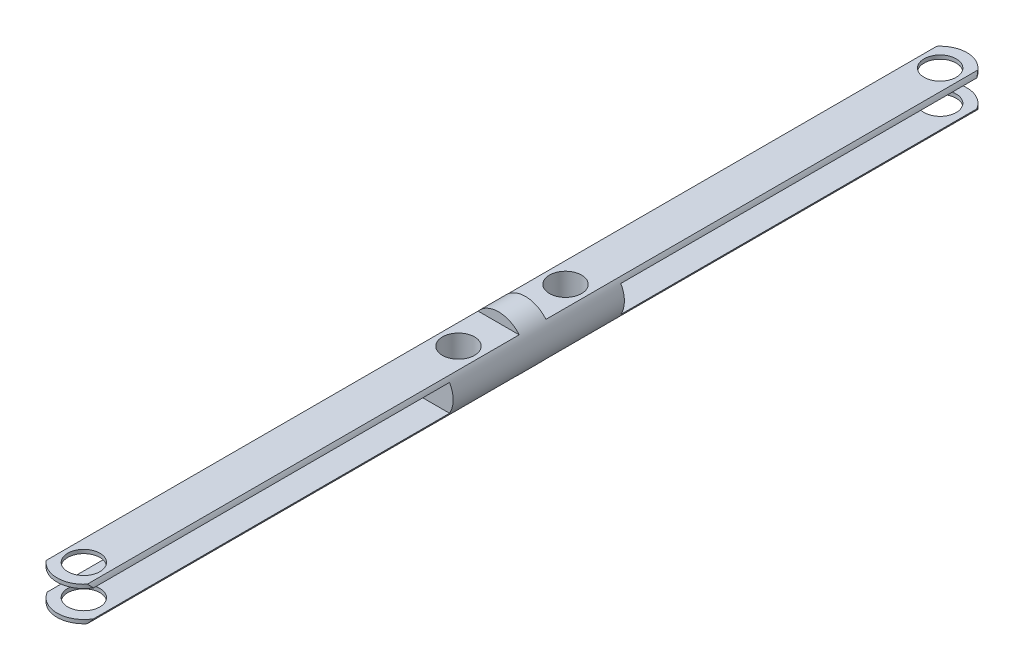
from build123d import *

# Parameters (mm, degrees)
EXTRUDE_1_DEPTH          = 100
CUT_EXTRUDE_START        = -1.6
CUT_EXTRUDE_2_OUTLINE_W  = 11.543856376
CUT_EXTRUDE_2_OUTLINE_H  = 103.894707388
CUT_EXTRUDE_2_OUTLINE_R  = 1.5
CUT_EXTRUDE_2_DEPTH      = 3.2
CUT_EXTRUDE_3_DEPTH      = 22
CUT_EXTRUDE_3_DEPTH_BACK = 22
SKETCH_6_W               = 64
SKETCH_6_H               = 2.5
EXTRUDE_START            = -1.25
SKETCH_7_R               = 2.5
EXTRUDE_2_DEPTH          = 1.25


# Read off the part's stored shape, not the designer's step: 切除-拉伸2
with BuildPart() as part:
    # 草图1 → 凸台-拉伸1 (new body)
    with BuildSketch(Plane.XY):
        with BuildLine():
            Line((1.920937271, 1.6), (0, 1.6))
            Line((0, 1.6), (0, -1.6))
            Line((0, -1.6), (1.920937271, -1.6))
            ThreePointArc((1.920937271, -1.6), (2.350781059, -0.850781059), (2.5, 0))
            ThreePointArc((2.5, 0), (2.350781059, 0.850781059), (1.920937271, 1.6))
        make_face()
        with BuildLine():
            Line((0, -1.6), (0, 1.6))
            Line((0, 1.6), (-1.920937271, 1.6))
            ThreePointArc((-1.920937271, 1.6), (-2.5, 0), (-1.920937271, -1.6))
            Line((-1.920937271, -1.6), (0, -1.6))
        make_face()
    extrude(amount=EXTRUDE_1_DEPTH)

    # 切除-拉伸2 outline → 切除-拉伸2 (cut)
    # profile 1 of 3: a face of its own
    with BuildSketch(Plane(origin=(0, 0, 0), x_dir=(1, 0, 0), z_dir=(0, 1, 0)).offset(CUT_EXTRUDE_START)):
        with Locations((0.333099219, -49.873134062)):
            Rectangle(CUT_EXTRUDE_2_OUTLINE_W, CUT_EXTRUDE_2_OUTLINE_H)
        with BuildLine():
            Line((-2.5, -50), (-2.5, -10))
            ThreePointArc((-2.5, -10), (0, -7.5), (2.5, -10))
            Line((2.5, -10), (2.5, -50))
            Line((2.5, -50), (-2.5, -50))
        make_face(mode=Mode.SUBTRACT)
    # profile 2 of 3: a face of its own
    with BuildSketch(Plane(origin=(0, 0, 0), x_dir=(1, 0, 0), z_dir=(0, 1, 0)).offset(CUT_EXTRUDE_START)):
        with Locations((0, -45)):
            Circle(CUT_EXTRUDE_2_OUTLINE_R)
    # profile 3 of 3: a face of its own
    with BuildSketch(Plane(origin=(0, 0, 0), x_dir=(1, 0, 0), z_dir=(0, 1, 0)).offset(CUT_EXTRUDE_START)):
        with Locations((0, -10)):
            Circle(CUT_EXTRUDE_2_OUTLINE_R)
    extrude(amount=CUT_EXTRUDE_2_DEPTH, mode=Mode.SUBTRACT)

    # 草图6 → 切除-拉伸3 (cut, two sides: drawn at the far end of the back side and taken through both)
    with BuildSketch(Plane(origin=(0, 0, 0), x_dir=(0, 0, -1), z_dir=(1, 0, 0)).offset(-CUT_EXTRUDE_3_DEPTH_BACK)):
        with Locations((-10, 0)):
            Rectangle(SKETCH_6_W, SKETCH_6_H)
    extrude(amount=CUT_EXTRUDE_3_DEPTH + CUT_EXTRUDE_3_DEPTH_BACK, mode=Mode.SUBTRACT)

    # 草图7 → 凸台-拉伸2 (add)
    with BuildSketch(Plane.XY.offset(50).offset(EXTRUDE_START)):
        with Locations(Location((0, 0, 0), (0, 0, 150))):
            Circle(SKETCH_7_R)
    extrude(amount=EXTRUDE_2_DEPTH)

    # 镜向1: part across face


with BuildPart() as part_1:
    add(part.part)
    add(part.part.mirror(Plane.XY.offset(50)))


solid = part_1.part
